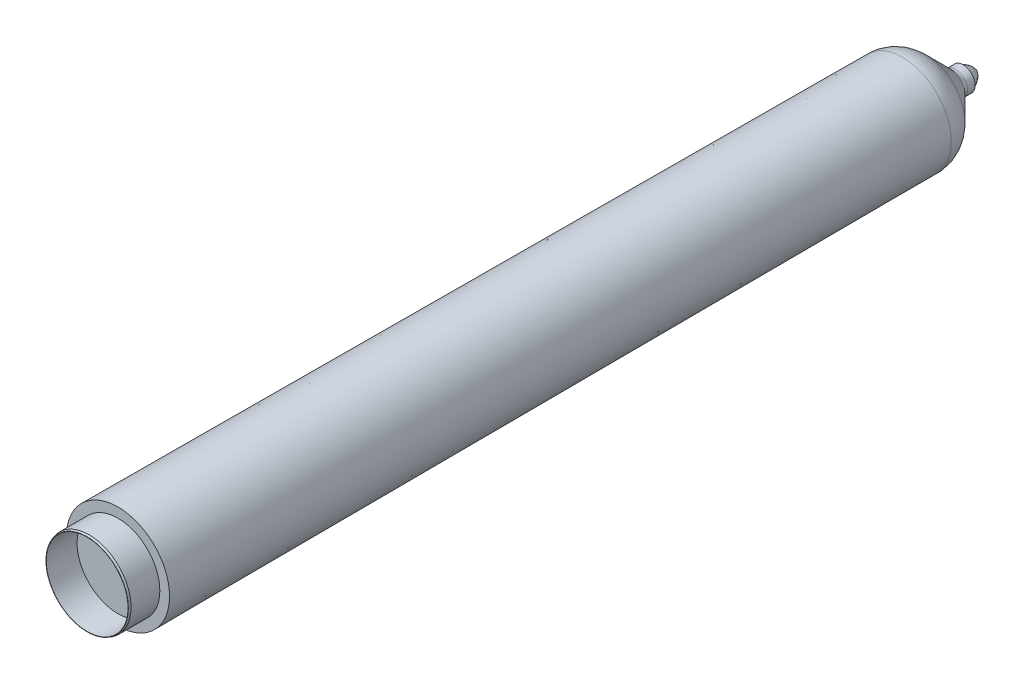
from build123d import *

# Parameters (mm, degrees)
SKETCH1_R           = 7.7
BOSS_EXTRUDE3_DEPTH = 126.14
BOSS_EXTRUDE3_DRAFT = -0.2
SKETCH3_R           = 6.25
SKETCH3_R_2         = 6.1
BOSS_EXTRUDE4_DEPTH = 4.6
CHAMFER2_SIZE       = 0.3
CHAMFER2_SIZE2      = 0.1
CROQUIS1_W          = 2
CROQUIS1_H          = 1.579896922
CHAFL_N1_SIZE       = 5
REDONDEO2_R         = 1
REDONDEO4_R         = 5


with BuildPart() as part:
    # Sketch1 → Boss-Extrude3 (with draft: the straight prism first)
    with BuildSketch(Plane.XY):
        Circle(SKETCH1_R)
    extrude(amount=-BOSS_EXTRUDE3_DEPTH)
    # Boss-Extrude3: the draft: its side faces are tilted about the plane it starts from
    boss_extrude3_sides = [part.faces().sort_by_distance(p)[0] for p in [
        (-7.7, 0, -63.07),
    ]]
    draft(boss_extrude3_sides, Plane.XY, BOSS_EXTRUDE3_DRAFT)

    # Sketch3 → Boss-Extrude4 (add)
    with BuildSketch(Plane.XY):
        Circle(SKETCH3_R)
        Circle(SKETCH3_R_2, mode=Mode.SUBTRACT)
    extrude(amount=BOSS_EXTRUDE4_DEPTH)

    # Chamfer2
    chamfer2_edges = [part.edges().sort_by_distance(p)[0] for p in [
        (-6.25, 0, 4.6),
    ]]
    chamfer2_side = [part.faces().sort_by_distance(p)[0] for p in [
        (-6.25, 0, 2.3),
    ]]
    chamfer(chamfer2_edges, length=CHAMFER2_SIZE, length2=CHAMFER2_SIZE2, reference=chamfer2_side[0])

    # Croquis1 → Cortar-Revolución1 (revolve, cut)
    with BuildSketch(Plane(origin=(0, 0, 0), x_dir=(0, 0, -1), z_dir=(1, 0, 0)), mode=Mode.PRIVATE) as cortar_revoluci_n1_sk:
        with Locations((125.14, 0.789948461)):
            Rectangle(CROQUIS1_W, CROQUIS1_H)
        Polygon((126.14, 1.779896922), (126.14, 7.259686548), (124.140012185, 7.266667851), (124.140012185, 1.779896922), align=None)
    revolve(cortar_revoluci_n1_sk.sketch.rotate(Axis((0, 0, -124.14), (0, 0, -1)), 180), axis=Axis((0, 0, -124.14), (0, 0, -1)), mode=Mode.SUBTRACT)

    # Chaflán1
    chafl_n1_edges = [part.edges().sort_by_distance(p)[0] for p in [
        (-7.266667851, 0, -124.140012185),
    ]]
    chamfer(chafl_n1_edges, length=CHAFL_N1_SIZE)

    # Redondeo2
    # the kernel refuses this fillet: 1 mm, written as the material it adds along each edge
    with BuildSketch(Plane(origin=(0, 0, -124.140012185), x_dir=(0, -1, 0), z_dir=(1, 0, 0))) as redondeo2_piece_1:
        with BuildLine():
            CenterArc((2.779896922, 0.858251665), REDONDEO2_R, 180, 59.120843086)
            Line((1.779896922, 0.858251665), (1.759896922, 0.858251665))
            Line((1.759896922, 0.858251665), (1.759896922, 0))
            Line((1.759896922, 0), (1.779896922, -0.02))
            ThreePointArc((1.779896922, -0.02), (2.023282386, -0.02), (2.256403269, -0.017165033))
            Line((2.256403269, -0.017165033), (2.266667851, 0))
        make_face()
    revolve(axis=Axis((0, 0, -124.140012185), (0, 0, -1)))

    # Redondeo4
    redondeo4_edges = [part.edges().sort_by_distance(p)[0] for p in [
        (-7.284121108, 0, -119.140042646),
    ]]
    fillet(redondeo4_edges, radius=REDONDEO4_R)


with BuildPart() as body_2:
    # Croquis2 → Revolución1 (revolve)
    with BuildSketch(Plane(origin=(0, 0, 0), x_dir=(0, 0, -1), z_dir=(1, 0, 0)), mode=Mode.PRIVATE) as revoluci_n1_sk:
        with BuildLine():
            Line((126.14, 0), (126.14, 1.579896922))
            ThreePointArc((126.14, 1.579896922), (127.316121132, 1.012901148), (128.14, 0))
            Line((128.14, 0), (126.14, 0))
        make_face()
    revolve(revoluci_n1_sk.sketch.rotate(Axis((0, 0, -126.431472853), (0, 0, 1)), 180), axis=Axis((0, 0, -126.431472853), (0, 0, 1)))


solid = Compound([part.part, body_2.part])
